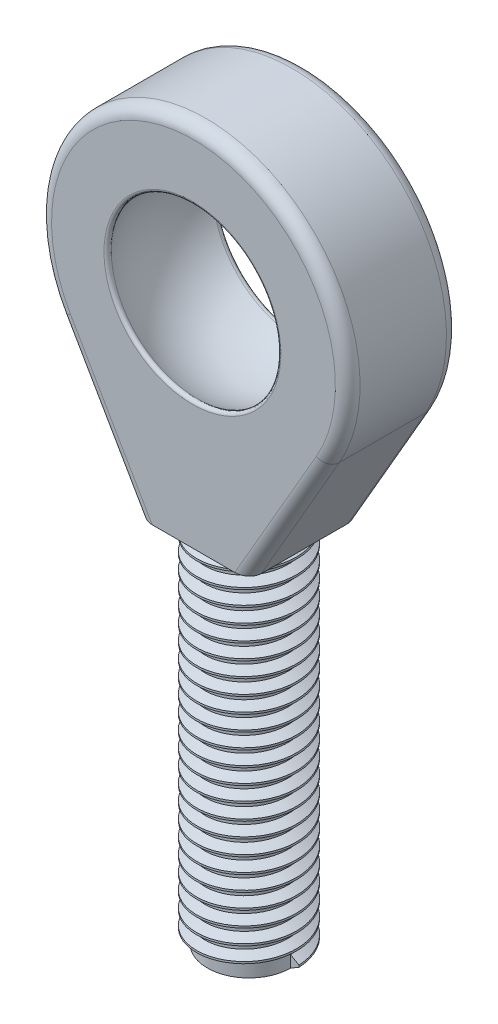
from build123d import *

# Parameters (mm, degrees)
EXTRUDE_1_DEPTH      = 4.5
EXTRUDE_1_DEPTH_BACK = 4.5
SKETCH_3_R           = 3.375
EXTRUDE_2_DEPTH      = 30
THREAD_2_PITCH       = 1.25
FILLET_1_R           = 1
FILLET_2_R           = 0.25


with BuildPart() as part:
    # Эскиз1 → Бобышка-Вытянуть1 (new, two sides: drawn at the far end of the back side and taken through both)
    with BuildSketch(Plane.XY.offset(-EXTRUDE_1_DEPTH_BACK)):
        with BuildLine():
            Line((-10.825317547, -6.25), (-4.5, -17.205771366))
            Line((-4.5, -17.205771366), (4.5, -17.205771366))
            Line((4.5, -17.205771366), (10.825317547, -6.25))
            ThreePointArc((10.825317547, -6.25), (0, 12.5), (-10.825317547, -6.25))
        make_face()
    extrude(amount=EXTRUDE_1_DEPTH + EXTRUDE_1_DEPTH_BACK)


with BuildPart() as body_2:
    # Эскиз2 → Повернуть4 (revolve)
    with BuildSketch(Plane.XY):
        with BuildLine():
            Line((-0.084968346, 7.999548761), (-0.084968346, -7.999548761))
            ThreePointArc((-0.084968346, -7.999548761), (8, 0), (-0.084968346, 7.999548761))
        make_face()
    revolve(axis=Axis((-0.084968346, -999.54893025, 0), (0, 1, 0)))


with BuildPart() as part_1:
    add(part.part)

    # Combine 1: cut body 2
    add(body_2.part, mode=Mode.SUBTRACT)

    # Sketch 3 → Бобышка-Вытянуть2 (add)
    with BuildSketch(Plane.XZ.offset(17.205771366)):
        with Locations(Location((0, 0, 0), (0, 0, 270))):
            Circle(SKETCH_3_R)
    extrude(amount=EXTRUDE_2_DEPTH)

    # Резьба2: the profile of Sketch 3 2 profile screwed along a right-hand helix of 24 turns, 8 arcs to a turn; built about Z, then put on its axis
    thread_2_z = Axis((0, 0, 0), (0, 0, 1))
    thread_2_corners = [(3.3747, 0, -0.000173205), (4.051582344, 0, 0.390624998), (4.051582344, 0, 0.546874998), (3.3747, 0, 0.937673202)]
    with BuildLine(mode=Mode.PRIVATE) as thread_2_profile:
        Line(thread_2_corners[0], thread_2_corners[1])
        Line(thread_2_corners[1], thread_2_corners[2])
        Line(thread_2_corners[2], thread_2_corners[3])
        Line(thread_2_corners[3], thread_2_corners[0])
    thread_2_cap = Face(thread_2_profile.wire())
    thread_2_turn_angles = [0, 22.5, 45, 67.5, 90, 112.5, 135, 157.5, 180, 202.5, 225, 247.5, 270, 292.5, 315, 337.5, 360]
    thread_2_turn_weights = [1, 0.9238795325112867, 1, 0.9238795325112867, 1, 0.9238795325112867, 1, 0.9238795325112867, 1, 0.9238795325112867, 1, 0.9238795325112867, 1, 0.9238795325112867, 1, 0.9238795325112867, 1]
    thread_2_turn_rails = [Edge.make_bspline([Vector(p[0], p[1], 0).rotate(thread_2_z, thread_2_turn_angles[k]) / thread_2_turn_weights[k] + Vector(0, 0, p[2] + THREAD_2_PITCH * thread_2_turn_angles[k] / 360) for k in range(17)], [0, 0, 0, 1, 1, 2, 2, 3, 3, 4, 4, 5, 5, 6, 6, 7, 7, 8, 8, 8], 2, thread_2_turn_weights) for p in thread_2_corners]
    thread_2_turn_sides = [Face.make_surface_from_curves(thread_2_turn_rails[p[0]], thread_2_turn_rails[p[1]]) for p in [(0, 1), (1, 2), (2, 3), (3, 0)]]
    thread_2 = Plane(origin=(0, -47.205771366, 0), x_dir=(1, 0, 0), z_dir=(0, 1, 0)) * Solid(Shell([*[p.moved(Location((0, 0, THREAD_2_PITCH * i))) for i in range(24) for p in thread_2_turn_sides], thread_2_cap, thread_2_cap.rotate(thread_2_z, 8640).moved(Location((0, 0, THREAD_2_PITCH * 8640 / 360)))]))
    add(thread_2)

    # Скругление1
    fillet_1_edges = [part_1.edges().sort_by_distance(p)[0] for p in [
        (0, 12.5, 4.5),
        (-7.662658774, -11.727885683, 4.5),
        (7.662658774, -11.727885683, -4.5),
        (7.662658774, -11.727885683, 4.5),
        (0, 12.5, -4.5),
        (-7.662658774, -11.727885683, -4.5),
    ]]
    fillet(fillet_1_edges, radius=FILLET_1_R)

    # Скругление2
    fillet_2_edges = [part_1.edges().sort_by_distance(p)[0] for p in [
        (-0.433763361, 6.662441836, -4.5),
        (0.263826663, 6.662441834, 4.5),
    ]]
    fillet(fillet_2_edges, radius=FILLET_2_R)


solid = part_1.part
